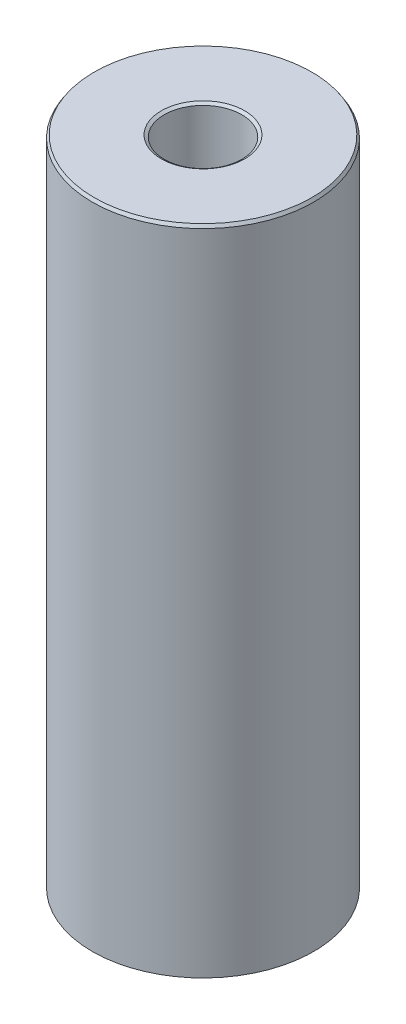
from build123d import *
from OCP.BRepFilletAPI import BRepFilletAPI_MakeChamfer

# Parameters (mm, degrees)
SKETCH1_R           = 7.5
BOSS_EXTRUDE1_DEPTH = 44.303641448
SKETCH2_R           = 2.624576364
CUT_EXTRUDE1_DEPTH  = 46.555599497
CHAMFER1_SIZE       = 0.201416689
CHAMFER1_SIZE2      = 0.128557557


with BuildPart() as part:
    # Sketch1 → Boss-Extrude1 (new body)
    with BuildSketch(Plane(origin=(0, 0, 0), x_dir=(1, 0, 0), z_dir=(0, 1, 0))):
        Circle(SKETCH1_R)
    extrude(amount=BOSS_EXTRUDE1_DEPTH)

    # Sketch2 → Cut-Extrude1 (cut, through all)
    with BuildSketch(Plane(origin=(0, 0, 0), x_dir=(1, 0, 0), z_dir=(0, 1, 0))):
        Circle(SKETCH2_R)
    extrude(amount=CUT_EXTRUDE1_DEPTH, mode=Mode.SUBTRACT)

    # Chamfer1: one chamfer whose edges measure the first distance from different faces: ONE call of the kernel's chamfer builder (chamfer() names one face for all edges)
    chamfer1_edges_1 = [part.edges().sort_by_distance(p)[0] for p in [
        (-2.624576364, 44.303641448, 0),
    ]]
    chamfer1_side_1 = [part.faces().sort_by_distance(p)[0] for p in [
        (-7.287867966, 44.303641448, 0),
    ]]
    chamfer1_edges_2 = [part.edges().sort_by_distance(p)[0] for p in [
        (-2.624576364, 0, 0),
    ]]
    chamfer1_side_2 = [part.faces().sort_by_distance(p)[0] for p in [
        (-2.624576364, 22.151820724, 0),
    ]]
    chamfer1_edges_3 = [part.edges().sort_by_distance(p)[0] for p in [
        (-7.5, 0, 0),
    ]]
    chamfer1_side_3 = [part.faces().sort_by_distance(p)[0] for p in [
        (-7.287867966, 0, 0),
    ]]
    chamfer1_edges_4 = [part.edges().sort_by_distance(p)[0] for p in [
        (-7.5, 44.303641448, 0),
    ]]
    chamfer1_side_4 = [part.faces().sort_by_distance(p)[0] for p in [
        (-7.5, 22.151820724, 0),
    ]]
    chamfer1 = BRepFilletAPI_MakeChamfer(part.part.solid().wrapped)
    for e in chamfer1_edges_1:
        chamfer1.Add(CHAMFER1_SIZE, CHAMFER1_SIZE2, e.wrapped, chamfer1_side_1[0].wrapped)  # the first distance lies on this face
    for e in chamfer1_edges_2:
        chamfer1.Add(CHAMFER1_SIZE, CHAMFER1_SIZE2, e.wrapped, chamfer1_side_2[0].wrapped)  # the first distance lies on this face
    for e in chamfer1_edges_3:
        chamfer1.Add(CHAMFER1_SIZE, CHAMFER1_SIZE2, e.wrapped, chamfer1_side_3[0].wrapped)  # the first distance lies on this face
    for e in chamfer1_edges_4:
        chamfer1.Add(CHAMFER1_SIZE, CHAMFER1_SIZE2, e.wrapped, chamfer1_side_4[0].wrapped)  # the first distance lies on this face
    add(Compound.cast(chamfer1.Shape()), mode=Mode.REPLACE)


solid = part.part
